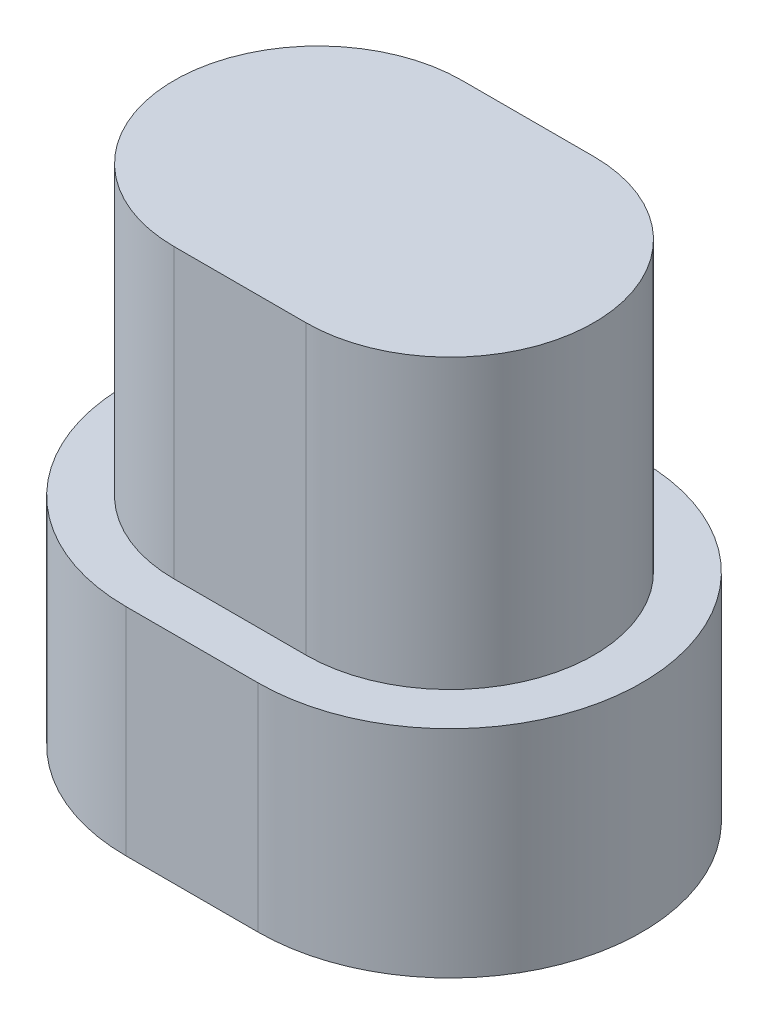
from build123d import *

# Parameters (mm, degrees)
EXTRUDE_1_DEPTH = 6
EXTRUDE_2_DEPTH = 4.5


with BuildPart() as part:
    # 草图1 → 凸台-拉伸1 (new body)
    with BuildSketch(Plane(origin=(0, 0, 0), x_dir=(1, 0, 0), z_dir=(0, 1, 0))):
        with BuildLine():
            Line((0, 3), (2.75, 3))
            ThreePointArc((2.75, 3), (5.75, 0), (2.75, -3))
            Line((2.75, -3), (0, -3))
            ThreePointArc((0, -3), (-3, 0), (0, 3))
        make_face()
    extrude(amount=EXTRUDE_1_DEPTH)

    # 草图2 → 凸台-拉伸2 (add)
    with BuildSketch(Plane.XZ):
        with BuildLine():
            Line((0, 4), (2.75, 4))
            ThreePointArc((2.75, 4), (6.75, 0), (2.75, -4))
            Line((2.75, -4), (0, -4))
            ThreePointArc((0, -4), (-4, 0), (0, 4))
        make_face()
    extrude(amount=EXTRUDE_2_DEPTH)


solid = part.part
